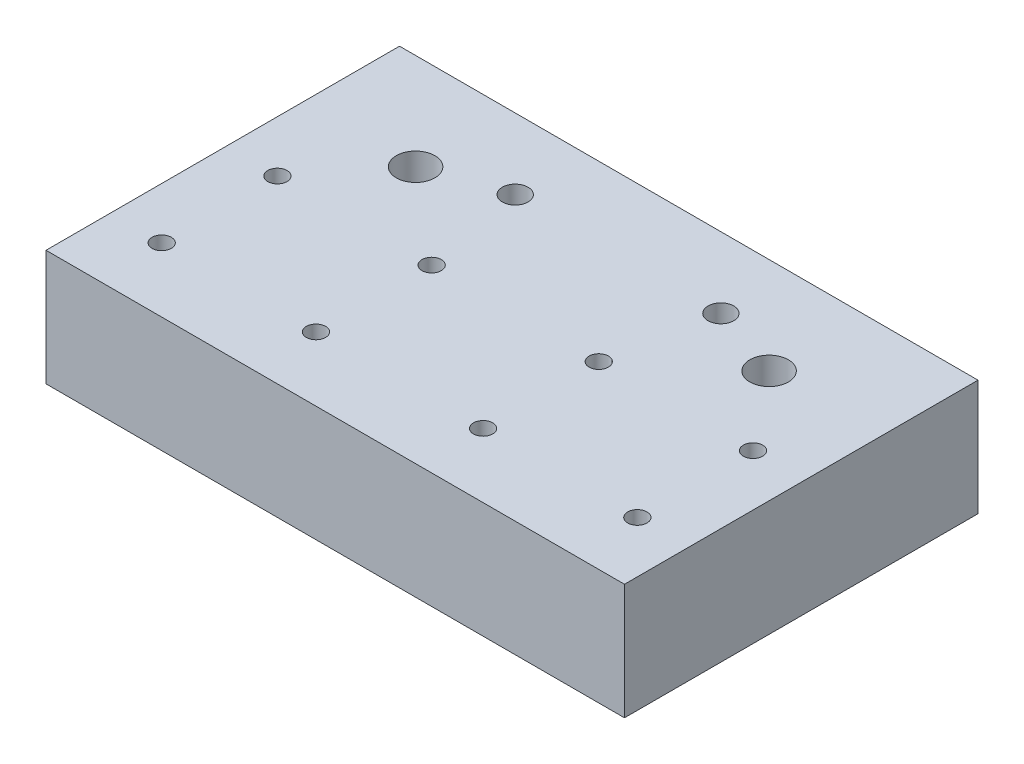
from build123d import *

# Parameters (mm, degrees)
SKETCH1_W           = 90
SKETCH1_H           = 55
SKETCH1_R           = 3
SKETCH1_R_2         = 1.5
BOSS_EXTRUDE1_DEPTH = 18
CUT_EXTRUDE1_REACH  = 59
SKETCH2_R           = 2


with BuildPart() as part:
    # Sketch1 → Boss-Extrude1 (new body)
    with BuildSketch(Plane(origin=(0, 0, 0), x_dir=(1, 0, 0), z_dir=(0, 1, 0))):
        with Locations((0, 2.5)):
            Rectangle(SKETCH1_W, SKETCH1_H)
        with Locations((27.5, 15)):
            Circle(SKETCH1_R, mode=Mode.SUBTRACT)
        with Locations((-27.5, 15)):
            Circle(SKETCH1_R, mode=Mode.SUBTRACT)
        with Locations((37, 3)):
            Circle(SKETCH1_R_2, mode=Mode.SUBTRACT)
        with Locations((13, 3)):
            Circle(SKETCH1_R_2, mode=Mode.SUBTRACT)
        with Locations((37, -15)):
            Circle(SKETCH1_R_2, mode=Mode.SUBTRACT)
        with Locations((13, -15)):
            Circle(SKETCH1_R_2, mode=Mode.SUBTRACT)
        with Locations((-37, -15)):
            Circle(SKETCH1_R_2, mode=Mode.SUBTRACT)
        with Locations((-37, 3)):
            Circle(SKETCH1_R_2, mode=Mode.SUBTRACT)
        with Locations((-13, -15)):
            Circle(SKETCH1_R_2, mode=Mode.SUBTRACT)
        with Locations((-13, 3)):
            Circle(SKETCH1_R_2, mode=Mode.SUBTRACT)
    extrude(amount=BOSS_EXTRUDE1_DEPTH)

    # Sketch2 → Cut-Extrude1 (cut, up to next)
    with BuildSketch(Plane(origin=(0, 18, 0), x_dir=(1, 0, 0), z_dir=(0, 1, 0)), mode=Mode.PRIVATE) as cut_extrude1_sk1:
        with Locations((16, 19)):
            Circle(SKETCH2_R)
    cut_extrude1_tool1 = extrude(cut_extrude1_sk1.sketch, amount=-CUT_EXTRUDE1_REACH, mode=Mode.PRIVATE) & part.part
    # Sketch2 → Cut-Extrude1 (cut, up to next)
    with BuildSketch(Plane(origin=(0, 18, 0), x_dir=(1, 0, 0), z_dir=(0, 1, 0)), mode=Mode.PRIVATE) as cut_extrude1_sk2:
        with Locations((-16, 19)):
            Circle(SKETCH2_R)
    cut_extrude1_tool2 = extrude(cut_extrude1_sk2.sketch, amount=-CUT_EXTRUDE1_REACH, mode=Mode.PRIVATE) & part.part
    add(cut_extrude1_tool1.solids().sort_by_distance((16, 18, -19))[0], mode=Mode.SUBTRACT)
    add(cut_extrude1_tool2.solids().sort_by_distance((-16, 18, -19))[0], mode=Mode.SUBTRACT)


solid = part.part
